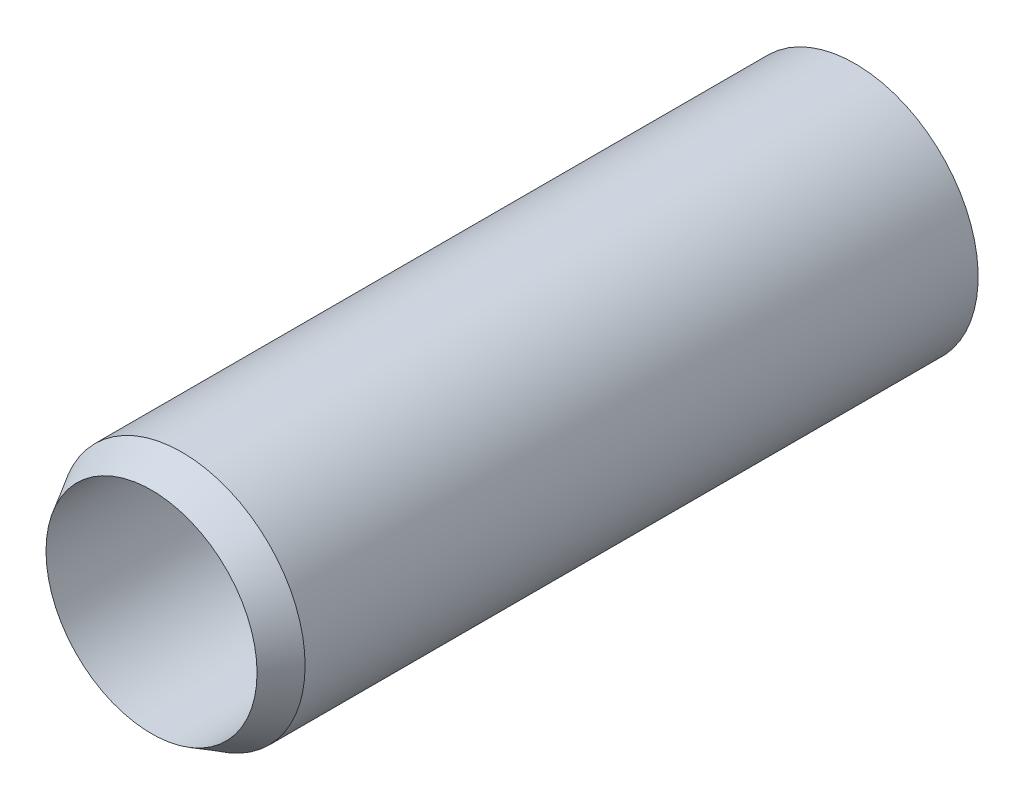
from build123d import *

# Parameters (mm, degrees)
SKETCH1_W       = 0.5
SKETCH1_H       = 20
CHAMFER1_SIZE   = 0.5
CHAMFER1_SIZE_2 = 0.866025404


with BuildPart() as part:
    # Sketch1 → Revolve1 (revolve)
    with BuildSketch(Plane.XZ.offset(-3.793105254), mode=Mode.PRIVATE) as revolve1_sk:
        with Locations((-13.370121658, 10)):
            Rectangle(SKETCH1_W, SKETCH1_H)
    revolve(revolve1_sk.sketch.rotate(Axis((-16.620121658, 3.793105254, 20), (0, 0, -1)), 180), axis=Axis((-16.620121658, 3.793105254, 20), (0, 0, -1)))

    # Chamfer1
    # the kernel refuses this chamfer: 0.866025404, 0.5 mm, written as the material it takes off along each edge
    with BuildSketch(Plane(origin=(-16.620121658, 3.793105254, 20), x_dir=(-1, 0, 0), z_dir=(0, -1, 0))) as chamfer1_piece_1:
        Polygon((3.5 - CHAMFER1_SIZE, 0), (3.5, CHAMFER1_SIZE_2), (3.5, 0), align=None)
    revolve(axis=Axis((-16.620121658, 3.793105254, 20), (0, 0, -1)), mode=Mode.SUBTRACT)


solid = part.part
